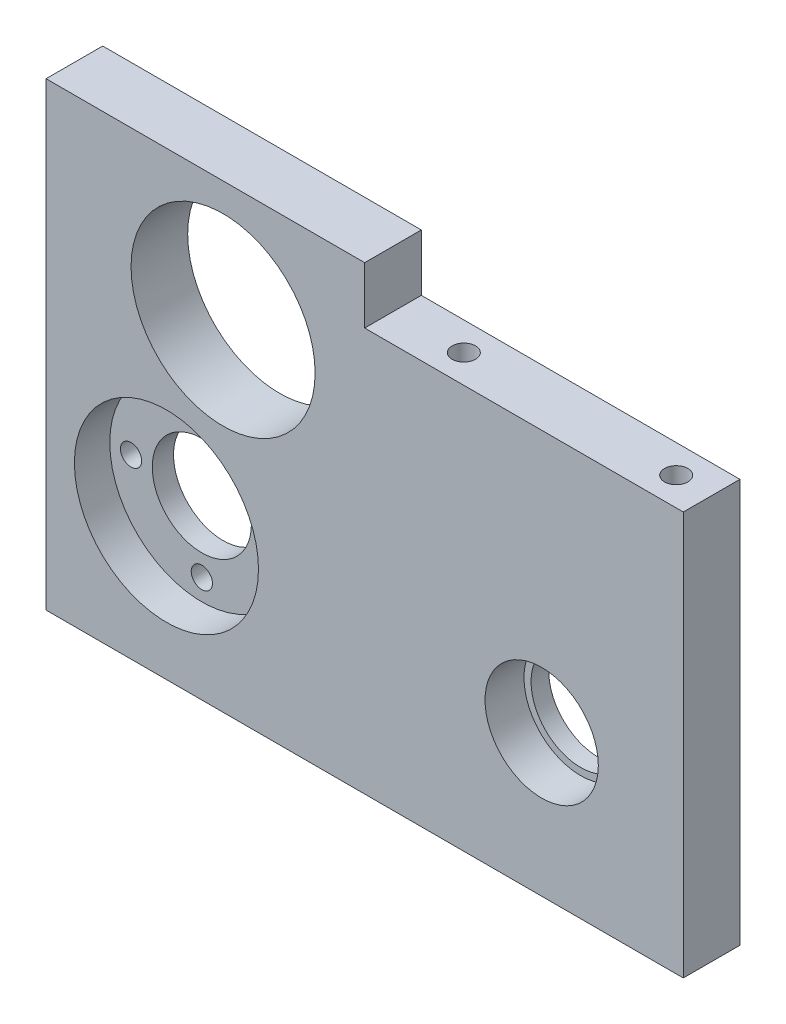
from build123d import *

# Parameters (mm, degrees)
ESQUISSE1_W             = 90
ESQUISSE1_H             = 65
ESQUISSE1_R             = 7
ESQUISSE1_R_2           = 13
BOSS_EXTRU_1_DEPTH      = 8
ESQUISSE2_R             = 13
BOSS_EXTRU_2_DEPTH      = 3
ESQUISSE3_R             = 7
ESQUISSE3_R_2           = 1.5
ENL_V_MAT_EXTRU_1_DEPTH = 112.130553854
ESQUISSE4_R             = 8
ENL_V_MAT_EXTRU_2_DEPTH = 5.5
ESQUISSE5_W             = 45
ESQUISSE5_H             = 8
ENL_V_MAT_EXTRU_3_DEPTH = 112.30588484
ESQUISSE6_R             = 1.65
ENL_V_MAT_EXTRU_4_DEPTH = 10
ESQUISSE7_R             = 1.65
ENL_V_MAT_EXTRU_5_DEPTH = 10


with BuildPart() as part:
    # Esquisse1 → Boss.-Extru.1 (new body)
    with BuildSketch(Plane.XY):
        with Locations((45, 32.5)):
            Rectangle(ESQUISSE1_W, ESQUISSE1_H)
        with Locations((70, 20)):
            Circle(ESQUISSE1_R, mode=Mode.SUBTRACT)
        with Locations((17, 20)):
            Circle(ESQUISSE1_R_2, mode=Mode.SUBTRACT)
        with Locations((25, 48)):
            Circle(ESQUISSE1_R_2, mode=Mode.SUBTRACT)
    extrude(amount=BOSS_EXTRU_1_DEPTH)

    # Esquisse2 → Boss.-Extru.2 (add)
    with BuildSketch(Plane(origin=(0, 0, 0), x_dir=(-1, 0, 0), z_dir=(0, 0, -1))):
        with Locations((-17, 20)):
            Circle(ESQUISSE2_R)
    extrude(amount=-BOSS_EXTRU_2_DEPTH)

    # Esquisse3 → Enlèv. mat.-Extru.1 (cut, through all)
    with BuildSketch(Plane.XY.offset(3)):
        with Locations((17, 20)):
            Circle(ESQUISSE3_R)
        with Locations((27, 20)):
            Circle(ESQUISSE3_R_2)
        with Locations((17, 10)):
            Circle(ESQUISSE3_R_2)
        with Locations((7, 20)):
            Circle(ESQUISSE3_R_2)
        with Locations((17, 30)):
            Circle(ESQUISSE3_R_2)
    extrude(amount=-ENL_V_MAT_EXTRU_1_DEPTH, mode=Mode.SUBTRACT)

    # Esquisse4 → Enlèv. mat.-Extru.2 (cut)
    with BuildSketch(Plane.XY.offset(8)):
        with Locations((70, 20)):
            Circle(ESQUISSE4_R)
    extrude(amount=-ENL_V_MAT_EXTRU_2_DEPTH, mode=Mode.SUBTRACT)

    # Esquisse5 → Enlèv. mat.-Extru.3 (cut, through all)
    with BuildSketch(Plane.XY.offset(8)):
        with Locations((67.5, 61)):
            Rectangle(ESQUISSE5_W, ESQUISSE5_H)
    extrude(amount=-ENL_V_MAT_EXTRU_3_DEPTH, mode=Mode.SUBTRACT)

    # Esquisse6 → Enlèv. mat.-Extru.4 (cut)
    with BuildSketch(Plane.ZY):
        with Locations((4, 7)):
            Circle(ESQUISSE6_R)
        with Locations((4, 45)):
            Circle(ESQUISSE6_R)
    extrude(amount=-ENL_V_MAT_EXTRU_4_DEPTH, mode=Mode.SUBTRACT)

    # Esquisse7 → Enlèv. mat.-Extru.5 (cut)
    with BuildSketch(Plane(origin=(0, 57, 0), x_dir=(1, 0, 0), z_dir=(0, 1, 0))):
        with Locations((85, -4)):
            Circle(ESQUISSE7_R)
        with Locations((55, -4)):
            Circle(ESQUISSE7_R)
    extrude(amount=-ENL_V_MAT_EXTRU_5_DEPTH, mode=Mode.SUBTRACT)


solid = part.part
